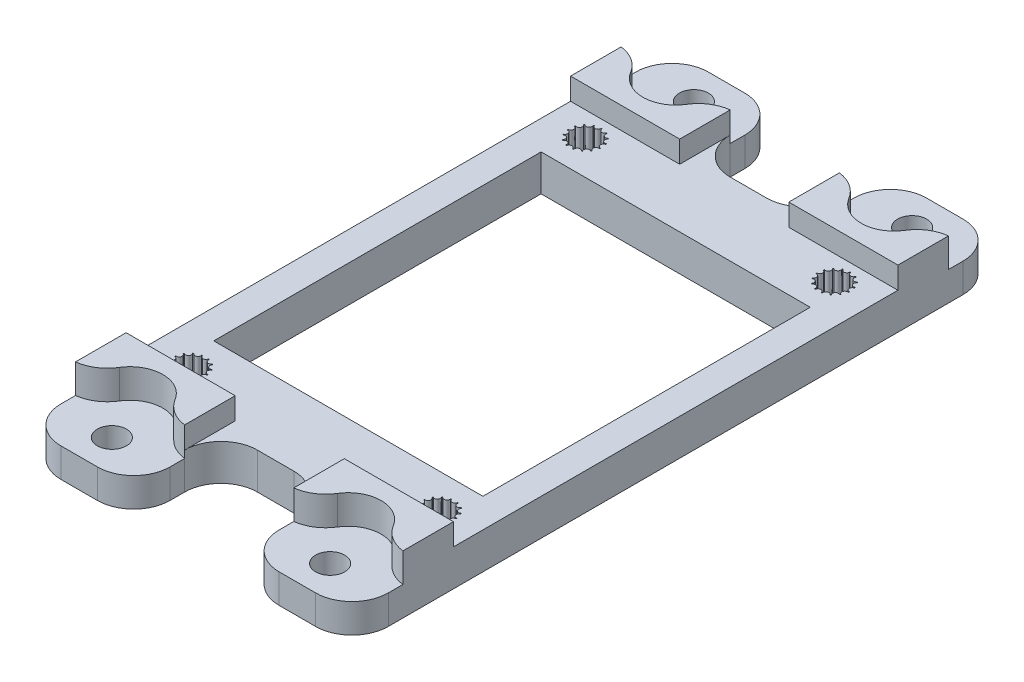
from build123d import *

# Parameters (mm, degrees)
SKETCH1_W                                  = 45
SKETCH1_H                                  = 65
BOSS_EXTRUDE1_DEPTH                        = 8
CUT_EXTRUDE1_DEPTH                         = 8
MIRROR1_AT_THE_SECOND_PLANE_COPY_1_DEPTH   = 8
SKETCH3_W                                  = 15
SKETCH3_H                                  = 12
SKETCH3_R                                  = 2
BOSS_EXTRUDE2_DEPTH                        = 8
MIRROR2_AT_THE_SECOND_PLANE_COPY_1_SKETC_W = 15
MIRROR2_AT_THE_SECOND_PLANE_COPY_1_SKETC_H = 12
MIRROR2_AT_THE_SECOND_PLANE_COPY_1_SKETC_R = 2
MIRROR2_AT_THE_SECOND_PLANE_COPY_1_DEPTH   = 8
FILLET1_R                                  = 5
CUT_EXTRUDE2_DEPTH                         = 4
MIRROR4_AT_THE_SECOND_PLANE_COPY_1_DEPTH   = 4
FILLET2_R                                  = 5
SKETCH5_W                                  = 37
SKETCH5_H                                  = 45
CUT_EXTRUDE3_DEPTH                         = 13
SKETCH6_W                                  = 15
SKETCH6_H                                  = 8.95
SKETCH6_H_2                                = 61.1
SKETCH6_W_2                                = 27.062082689
CUT_EXTRUDE4_DEPTH                         = 3


with BuildPart() as part:
    # Sketch1 → Boss-Extrude1 (new body)
    with BuildSketch(Plane(origin=(0, 0, 0), x_dir=(1, 0, 0), z_dir=(0, 1, 0))):
        with Locations((22.5, 32.5)):
            Rectangle(SKETCH1_W, SKETCH1_H)
    extrude(amount=BOSS_EXTRUDE1_DEPTH)

    # Sketch2 → Cut-Extrude1 (cut)
    with BuildSketch(Plane(origin=(0, 8, 0), x_dir=(1, 0, 0), z_dir=(0, 1, 0))):
        with BuildLine():
            ThreePointArc((7.560667609, 4.672293474), (7.239865506, 5.106622343), (7.643959363, 5.464761577))
            ThreePointArc((7.643959363, 5.464761577), (7.637674265, 5.535189042), (7.629179325, 5.605384245))
            ThreePointArc((7.629179325, 5.605384245), (7.159454555, 5.87168144), (7.382944313, 6.363217688))
            ThreePointArc((7.382944313, 6.363217688), (7.348557159, 6.425), (7.312245684, 6.485671305))
            ThreePointArc((7.312245684, 6.485671305), (6.774817927, 6.537891622), (6.779060176, 7.077833803))
            ThreePointArc((6.779060176, 7.077833803), (6.722516818, 7.120288237), (6.664667392, 7.160945025))
            ThreePointArc((6.664667392, 7.160945025), (6.15246279, 6.990059097), (5.936724007, 7.485046302))
            ThreePointArc((5.936724007, 7.485046302), (5.867801304, 7.500832102), (5.798416619, 7.514444444))
            ThreePointArc((5.798416619, 7.514444444), (5.4, 7.15), (5.001583381, 7.514444444))
            ThreePointArc((5.001583381, 7.514444444), (4.932198696, 7.500832102), (4.863275993, 7.485046302))
            ThreePointArc((4.863275993, 7.485046302), (4.879414078, 7.421153089), (4.884842553, 7.35547728))
            ThreePointArc((4.884842553, 7.35547728), (4.585331413, 6.968305497), (4.135332608, 7.160945025))
            ThreePointArc((4.135332608, 7.160945025), (4.077483182, 7.120288237), (4.020939824, 7.077833803))
            ThreePointArc((4.020939824, 7.077833803), (4.100218564, 6.951820533), (4.127924143, 6.805543864))
            ThreePointArc((4.127924143, 6.805543864), (3.90671462, 6.447725523), (3.487754316, 6.485671305))
            ThreePointArc((3.487754316, 6.485671305), (3.451442841, 6.425), (3.417055687, 6.363217688))
            ThreePointArc((3.417055687, 6.363217688), (3.593869104, 6.215772772), (3.660122838, 5.995288237))
            ThreePointArc((3.660122838, 5.995288237), (3.509400931, 5.682461716), (3.170820675, 5.605384245))
            ThreePointArc((3.170820675, 5.605384245), (3.162325735, 5.535189042), (3.156040637, 5.464761577))
            ThreePointArc((3.156040637, 5.464761577), (3.442937532, 5.349867127), (3.562325735, 5.064810958))
            ThreePointArc((3.562325735, 5.064810958), (3.471196794, 4.810648276), (3.239332391, 4.672293474))
            ThreePointArc((3.239332391, 4.672293474), (3.260122838, 4.604711763), (3.283026546, 4.537816691))
            ThreePointArc((3.283026546, 4.537816691), (3.666656087, 4.512169481), (3.851442841, 4.175))
            ThreePointArc((3.851442841, 4.175), (3.80640772, 3.990609287), (3.681443165, 3.847738864))
            ThreePointArc((3.681443165, 3.847738864), (3.727924143, 3.794456136), (3.776056398, 3.742660224))
            ThreePointArc((3.776056398, 3.742660224), (4.217892025, 3.854258631), (4.477483182, 3.479711763))
            ThreePointArc((4.477483182, 3.479711763), (4.463028211, 3.373151777), (4.420708029, 3.274293398))
            ThreePointArc((4.420708029, 3.274293398), (4.484842553, 3.24452272), (4.549880851, 3.216781953))
            ThreePointArc((4.549880851, 3.216781953), (4.991666595, 3.494722659), (5.332198696, 3.099167898))
            ThreePointArc((5.332198696, 3.099167898), (5.331473708, 3.075095823), (5.329301372, 3.051111007))
            ThreePointArc((5.329301372, 3.051111007), (5.4, 3.05), (5.470698628, 3.051111007))
            ThreePointArc((5.470698628, 3.051111007), (5.784636628, 3.490426939), (6.250119149, 3.216781953))
            ThreePointArc((6.250119149, 3.216781953), (6.315157447, 3.24452272), (6.379291971, 3.274293398))
            ThreePointArc((6.379291971, 3.274293398), (6.487402717, 3.80331856), (7.023943602, 3.742660224))
            ThreePointArc((7.023943602, 3.742660224), (7.072075857, 3.794456136), (7.118556835, 3.847738864))
            ThreePointArc((7.118556835, 3.847738864), (7.002146997, 4.375), (7.516973454, 4.537816691))
            ThreePointArc((7.516973454, 4.537816691), (7.539877162, 4.604711763), (7.560667609, 4.672293474))
        make_face()
    cut_extrude1 = extrude(amount=-CUT_EXTRUDE1_DEPTH, mode=Mode.SUBTRACT)

    # Mirror1: Cut-Extrude1 across plane
    add(cut_extrude1.mirror(Plane(origin=(0, 0, -32.5), x_dir=(1, 0, 0), z_dir=(0, 0, -1))), mode=Mode.SUBTRACT)

    # Mirror1 at the second plane: Cut-Extrude1 across plane
    add(cut_extrude1.mirror(Plane.ZY.offset(-22.5)), mode=Mode.SUBTRACT)

    # Mirror1 at the second plane copy 1 sketc → Mirror1 at the second plane copy 1 (cut)
    with BuildSketch(Plane(origin=(45, 8, -65), x_dir=(-1, 0, 0), z_dir=(0, 1, 0))):
        with BuildLine():
            ThreePointArc((7.560667609, 4.672293474), (7.239865506, 5.106622343), (7.643959363, 5.464761577))
            ThreePointArc((7.643959363, 5.464761577), (7.637674265, 5.535189042), (7.629179325, 5.605384245))
            ThreePointArc((7.629179325, 5.605384245), (7.159454555, 5.87168144), (7.382944313, 6.363217688))
            ThreePointArc((7.382944313, 6.363217688), (7.348557159, 6.425), (7.312245684, 6.485671305))
            ThreePointArc((7.312245684, 6.485671305), (6.774817927, 6.537891622), (6.779060176, 7.077833803))
            ThreePointArc((6.779060176, 7.077833803), (6.722516818, 7.120288237), (6.664667392, 7.160945025))
            ThreePointArc((6.664667392, 7.160945025), (6.15246279, 6.990059097), (5.936724007, 7.485046302))
            ThreePointArc((5.936724007, 7.485046302), (5.867801304, 7.500832102), (5.798416619, 7.514444444))
            ThreePointArc((5.798416619, 7.514444444), (5.4, 7.15), (5.001583381, 7.514444444))
            ThreePointArc((5.001583381, 7.514444444), (4.932198696, 7.500832102), (4.863275993, 7.485046302))
            ThreePointArc((4.863275993, 7.485046302), (4.879414078, 7.421153089), (4.884842553, 7.35547728))
            ThreePointArc((4.884842553, 7.35547728), (4.585331413, 6.968305497), (4.135332608, 7.160945025))
            ThreePointArc((4.135332608, 7.160945025), (4.077483182, 7.120288237), (4.020939824, 7.077833803))
            ThreePointArc((4.020939824, 7.077833803), (4.100218564, 6.951820533), (4.127924143, 6.805543864))
            ThreePointArc((4.127924143, 6.805543864), (3.90671462, 6.447725523), (3.487754316, 6.485671305))
            ThreePointArc((3.487754316, 6.485671305), (3.451442841, 6.425), (3.417055687, 6.363217688))
            ThreePointArc((3.417055687, 6.363217688), (3.593869104, 6.215772772), (3.660122838, 5.995288237))
            ThreePointArc((3.660122838, 5.995288237), (3.509400931, 5.682461716), (3.170820675, 5.605384245))
            ThreePointArc((3.170820675, 5.605384245), (3.162325735, 5.535189042), (3.156040637, 5.464761577))
            ThreePointArc((3.156040637, 5.464761577), (3.442937532, 5.349867127), (3.562325735, 5.064810958))
            ThreePointArc((3.562325735, 5.064810958), (3.471196794, 4.810648276), (3.239332391, 4.672293474))
            ThreePointArc((3.239332391, 4.672293474), (3.260122838, 4.604711763), (3.283026546, 4.537816691))
            ThreePointArc((3.283026546, 4.537816691), (3.666656087, 4.512169481), (3.851442841, 4.175))
            ThreePointArc((3.851442841, 4.175), (3.80640772, 3.990609287), (3.681443165, 3.847738864))
            ThreePointArc((3.681443165, 3.847738864), (3.727924143, 3.794456136), (3.776056398, 3.742660224))
            ThreePointArc((3.776056398, 3.742660224), (4.217892025, 3.854258631), (4.477483182, 3.479711763))
            ThreePointArc((4.477483182, 3.479711763), (4.463028211, 3.373151777), (4.420708029, 3.274293398))
            ThreePointArc((4.420708029, 3.274293398), (4.484842553, 3.24452272), (4.549880851, 3.216781953))
            ThreePointArc((4.549880851, 3.216781953), (4.991666595, 3.494722659), (5.332198696, 3.099167898))
            ThreePointArc((5.332198696, 3.099167898), (5.331473708, 3.075095823), (5.329301372, 3.051111007))
            ThreePointArc((5.329301372, 3.051111007), (5.4, 3.05), (5.470698628, 3.051111007))
            ThreePointArc((5.470698628, 3.051111007), (5.784636628, 3.490426939), (6.250119149, 3.216781953))
            ThreePointArc((6.250119149, 3.216781953), (6.315157447, 3.24452272), (6.379291971, 3.274293398))
            ThreePointArc((6.379291971, 3.274293398), (6.487402717, 3.80331856), (7.023943602, 3.742660224))
            ThreePointArc((7.023943602, 3.742660224), (7.072075857, 3.794456136), (7.118556835, 3.847738864))
            ThreePointArc((7.118556835, 3.847738864), (7.002146997, 4.375), (7.516973454, 4.537816691))
            ThreePointArc((7.516973454, 4.537816691), (7.539877162, 4.604711763), (7.560667609, 4.672293474))
        make_face()
    extrude(amount=-MIRROR1_AT_THE_SECOND_PLANE_COPY_1_DEPTH, mode=Mode.SUBTRACT)

    # Sketch3 → Boss-Extrude2 (add)
    with BuildSketch(Plane(origin=(0, 8, 0), x_dir=(1, 0, 0), z_dir=(0, 1, 0))):
        with Locations((7.5, -6)):
            Rectangle(SKETCH3_W, SKETCH3_H)
        with Locations(Location((7.5, -7.5, 0), (0, 0, 270))):
            Circle(SKETCH3_R, mode=Mode.SUBTRACT)
    boss_extrude2 = extrude(amount=-BOSS_EXTRUDE2_DEPTH)

    # Mirror2: Boss-Extrude2 across plane
    add(boss_extrude2.mirror(Plane(origin=(0, 0, -32.5), x_dir=(1, 0, 0), z_dir=(0, 0, -1))))

    # Mirror2 at the second plane: Boss-Extrude2 across plane
    add(boss_extrude2.mirror(Plane.ZY.offset(-22.5)))

    # Mirror2 at the second plane copy 1 sketc → Mirror2 at the second plane copy 1 (add)
    with BuildSketch(Plane(origin=(45, 8, -65), x_dir=(-1, 0, 0), z_dir=(0, 1, 0))):
        with Locations((7.5, -6)):
            Rectangle(MIRROR2_AT_THE_SECOND_PLANE_COPY_1_SKETC_W, MIRROR2_AT_THE_SECOND_PLANE_COPY_1_SKETC_H)
        with Locations(Location((7.5, -7.5, 0), (0, 0, 270))):
            Circle(MIRROR2_AT_THE_SECOND_PLANE_COPY_1_SKETC_R, mode=Mode.SUBTRACT)
    extrude(amount=-MIRROR2_AT_THE_SECOND_PLANE_COPY_1_DEPTH)

    # Fillet1
    fillet1_edges = [part.edges().sort_by_distance(p)[0] for p in [
        (0, 4, 12),
        (15, 4, 0),
        (15, 4, 12),
        (45, 4, 12),
        (30, 4, 12),
        (30, 4, 0),
        (0, 4, -77),
        (15, 4, -77),
        (15, 4, -65),
        (45, 4, -77),
        (30, 4, -65),
        (30, 4, -77),
    ]]
    fillet(fillet1_edges, radius=FILLET1_R)

    # Sketch4 → Cut-Extrude2 (cut)
    with BuildSketch(Plane(origin=(0, 8, 0), x_dir=(1, 0, 0), z_dir=(0, 1, 0))):
        with BuildLine():
            Line((12, -5), (15, -5))
            Line((15, -5), (15, -14.056174566))
            Line((15, -14.056174566), (0, -14.056174566))
            Line((0, -14.056174566), (0, -5))
            Line((0, -5), (3, -5))
            ThreePointArc((3, -5), (7.5, -0.5), (12, -5))
        make_face()
    cut_extrude2 = extrude(amount=-CUT_EXTRUDE2_DEPTH, mode=Mode.SUBTRACT)

    # Mirror4: Cut-Extrude2 across plane
    add(cut_extrude2.mirror(Plane(origin=(0, 0, -32.5), x_dir=(1, 0, 0), z_dir=(0, 0, -1))), mode=Mode.SUBTRACT)

    # Mirror4 at the second plane: Cut-Extrude2 across plane
    add(cut_extrude2.mirror(Plane.ZY.offset(-22.5)), mode=Mode.SUBTRACT)

    # Mirror4 at the second plane copy 1 sketc → Mirror4 at the second plane copy 1 (cut)
    with BuildSketch(Plane(origin=(45, 8, -65), x_dir=(-1, 0, 0), z_dir=(0, 1, 0))):
        with BuildLine():
            Line((12, -5), (15, -5))
            Line((15, -5), (15, -14.056174566))
            Line((15, -14.056174566), (0, -14.056174566))
            Line((0, -14.056174566), (0, -5))
            Line((0, -5), (3, -5))
            ThreePointArc((3, -5), (7.5, -0.5), (12, -5))
        make_face()
    extrude(amount=-MIRROR4_AT_THE_SECOND_PLANE_COPY_1_DEPTH, mode=Mode.SUBTRACT)

    # Fillet2
    # the kernel refuses this fillet: 5 mm, written as the material it takes off along each edge
    with BuildSketch(Plane(origin=(12, 15.5, 5), x_dir=(1, 0, 0), z_dir=(0, -1, 0)), Plane(origin=(42, 15.5, 5), x_dir=(1, 0, 0), z_dir=(0, -1, 0)), Plane(origin=(3, 15.5, -70), x_dir=(-1, 0, 0), z_dir=(0, -1, 0)), Plane(origin=(33, 15.5, -70), x_dir=(-1, 0, 0), z_dir=(0, -1, 0))) as fillet2_piece_1:
        with BuildLine():
            CenterArc((3.6, -4.963869458), FILLET2_R, 96.892102579, 51.606955981)
            Line((-0.663157895, -2.351306586), (-0.748421053, -2.299055328))
            ThreePointArc((-0.748421053, -2.299055328), (-0.265206772, -1.194372771), (-0.1, 0))
            Line((-0.1, 0), (0, 0.1))
            ThreePointArc((0, 0.1), (1.5, 0.1), (2.988, 0.099277389))
            Line((2.988, 0.099277389), (3, 0))
        make_face()
    extrude(amount=11.5, mode=Mode.SUBTRACT)
    with BuildSketch(Plane(origin=(3, 15.5, 5), x_dir=(0.27144835701538245, 0, -0.9624530063715577), z_dir=(0, -1, 0)), Plane(origin=(12, 15.5, -70), x_dir=(-0.2714483570153823, 0, 0.9624530063715577), z_dir=(0, -1, 0)), Plane(origin=(42, 15.5, -70), x_dir=(-0.2714483570153834, 0, 0.9624530063715573), z_dir=(0, -1, 0))) as fillet2_piece_2:
        with BuildLine():
            CenterArc((3.800276998, -4.812265032), FILLET2_R, 105.75047072, 51.606955981)
            Line((-0.814345071, -2.887359019), (-0.906637512, -2.848860899))
            ThreePointArc((-0.906637512, -2.848860899), (-0.503417836, -1.416534674), (-0.096245301, 0.027144836))
            Line((-0.096245301, 0.027144836), (0.027144836, 0.096245301))
            ThreePointArc((0.027144836, 0.096245301), (1.221517607, -0.068961471), (2.415890377, 0.096245301))
            Line((2.415890377, 0.096245301), (2.443035213, 0))
        make_face()
    extrude(amount=11.5, mode=Mode.SUBTRACT)
    with BuildSketch(Plane(origin=(33, 15.5, 5), x_dir=(-1, 0, 0), z_dir=(0, -1, 0))) as fillet2_piece_3:
        with BuildLine():
            CenterArc((3.6, 4.963869458), FILLET2_R, 211.50094144, 51.606955981)
            Line((-0.663157895, 2.351306586), (-0.748421053, 2.299055328))
            ThreePointArc((-0.748421053, 2.299055328), (-0.265206772, 1.194372771), (-0.1, 0))
            Line((-0.1, 0), (0, -0.1))
            ThreePointArc((0, -0.1), (1.5, -0.1), (2.988, -0.099277389))
            Line((2.988, -0.099277389), (3, 0))
        make_face()
    extrude(amount=11.5, mode=Mode.SUBTRACT)

    # Sketch5 → Cut-Extrude3 (cut)
    with BuildSketch(Plane(origin=(0, 8, 0), x_dir=(1, 0, 0), z_dir=(0, 1, 0))):
        with Locations((22.5, 32.5)):
            Rectangle(SKETCH5_W, SKETCH5_H)
    extrude(amount=-CUT_EXTRUDE3_DEPTH, mode=Mode.SUBTRACT)

    # Sketch6 → Cut-Extrude4 (cut)
    with BuildSketch(Plane(origin=(0, 8, 0), x_dir=(1, 0, 0), z_dir=(0, 1, 0))):
        with Locations((22.5, 67.525)):
            Rectangle(SKETCH6_W, SKETCH6_H)
        with Locations((22.5, 32.5)):
            Rectangle(SKETCH6_W, SKETCH6_H_2)
        with Locations((1.468958656, 32.5)):
            Rectangle(SKETCH6_W_2, SKETCH6_H_2)
        with Locations((43.531041345, 32.5)):
            Rectangle(SKETCH6_W_2, SKETCH6_H_2)
        with Locations((22.5, -2.525)):
            Rectangle(SKETCH6_W, SKETCH6_H)
    extrude(amount=-CUT_EXTRUDE4_DEPTH, mode=Mode.SUBTRACT)


solid = part.part
